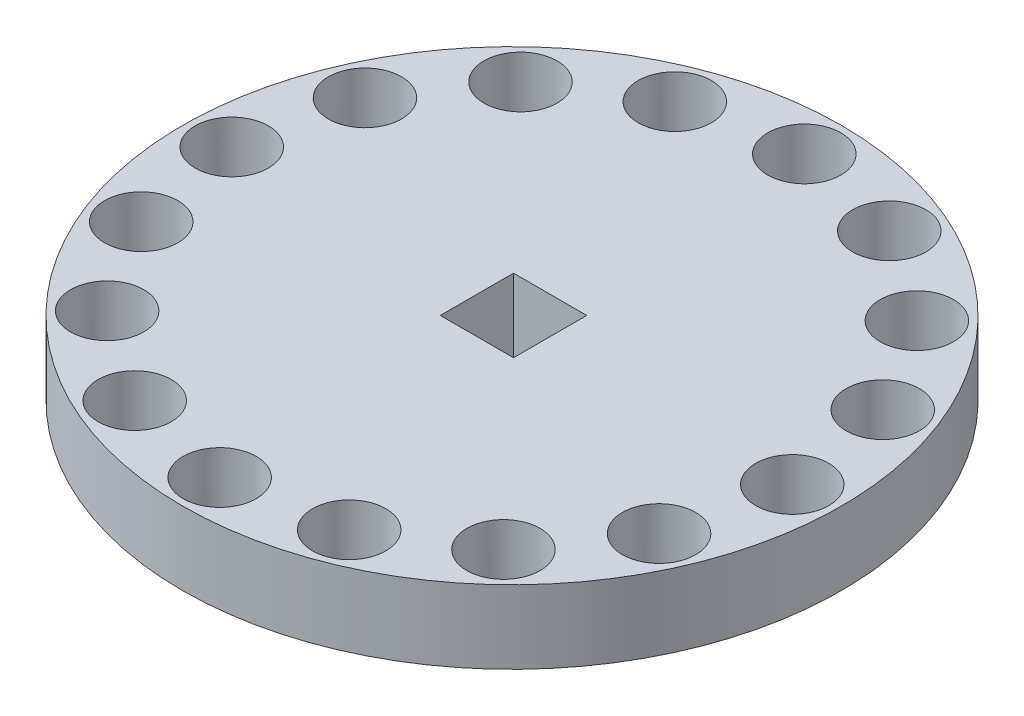
from build123d import *

# Parameters (mm, degrees)
SKIZZE1_R                       = 9
AUFSATZ_LINEAR_AUSTRAGEN1_DEPTH = 2
SKIZZE3_W                       = 2
SKIZZE3_H                       = 2
SCHNITT_LINEAR_AUSTRAGEN1_DEPTH = 3
SKIZZE4_R                       = 1
SCHNITT_LINEAR_AUSTRAGEN2_DEPTH = 3
KREISMUSTER1_COUNT              = 16


with BuildPart() as part:
    # Skizze1 → Aufsatz-Linear austragen1 (new body)
    with BuildSketch(Plane(origin=(0, 0, 0), x_dir=(1, 0, 0), z_dir=(0, 1, 0))):
        Circle(SKIZZE1_R)
    extrude(amount=AUFSATZ_LINEAR_AUSTRAGEN1_DEPTH)

    # Skizze3 → Schnitt-Linear austragen1 (cut)
    with BuildSketch(Plane(origin=(0, 2, 0), x_dir=(1, 0, 0), z_dir=(0, 1, 0))):
        with Locations((0.014205659, 0.027357499)):
            Rectangle(SKIZZE3_W, SKIZZE3_H)
    extrude(amount=-SCHNITT_LINEAR_AUSTRAGEN1_DEPTH, mode=Mode.SUBTRACT)

    # Skizze4 → Schnitt-Linear austragen2 (cut)
    with BuildSketch(Plane(origin=(0, 2, 0), x_dir=(1, 0, 0), z_dir=(0, 1, 0))):
        with Locations((7.817951829, -0.164692324)):
            Circle(SKIZZE4_R)
    schnitt_linear_austragen2 = extrude(amount=-SCHNITT_LINEAR_AUSTRAGEN2_DEPTH, mode=Mode.SUBTRACT)

    # Kreismuster1: Schnitt-Linear austragen2 ×16 about axis
    kreismuster1_axis = Axis((0, 2, 0), (0, -1, 0))
    for i in range(1, KREISMUSTER1_COUNT):
        add(schnitt_linear_austragen2.rotate(kreismuster1_axis, i * 360 / KREISMUSTER1_COUNT), mode=Mode.SUBTRACT)


solid = part.part
